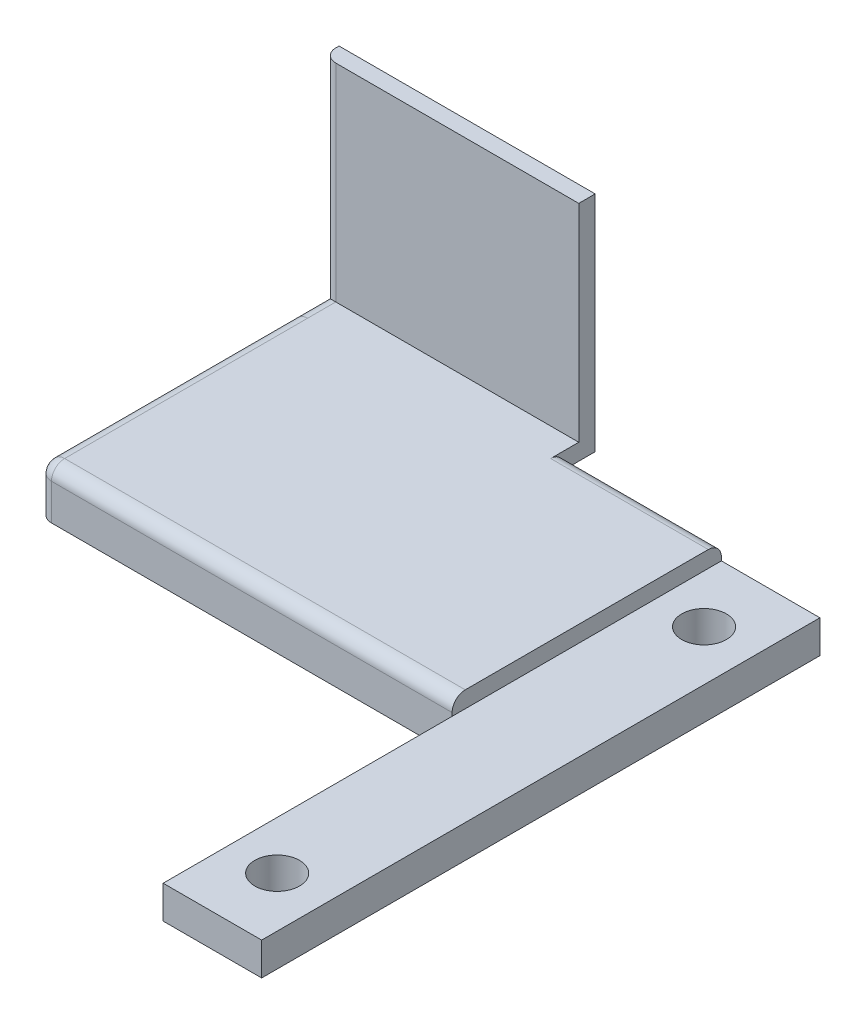
from build123d import *

# Parameters (mm, degrees)
SKETCH_1_W          = 40
SKETCH_1_H          = 85
EXTRUDE_1_DEPTH     = 5
SKETCH_2_W          = 25
SKETCH_2_H          = 85
EXTRUDE_2_DEPTH     = 2.5
EXTRUDE_START       = -7.5
SKETCH_5_W          = 38
SKETCH_5_H          = 85
EXTRUDE_3_DEPTH     = 7.5
SKETCH_3_R          = 3.4
CUT_EXTRUDE_1_DEPTH = 95.074438611
SKETCH_6_R          = 3.4
CUT_EXTRUDE_2_DEPTH = 95.074438611
FILLET_1_R          = 2
FILLET_2_R          = 2
SKETCH_7_W          = 63
SKETCH_7_H          = 17.986542749
CUT_EXTRUDE_3_DEPTH = 44
FILLET_3_R          = 2
EXTRUDE_4_DEPTH     = 39
FILLET_4_R          = 2


with BuildPart() as part:
    # 草图1 → 凸台-拉伸1 (new body)
    with BuildSketch(Plane(origin=(0, 0, 0), x_dir=(1, 0, 0), z_dir=(0, 1, 0))):
        with Locations((20, -42.5)):
            Rectangle(SKETCH_1_W, SKETCH_1_H)
    extrude(amount=EXTRUDE_1_DEPTH)

    # 草图2 → 凸台-拉伸2 (add)
    with BuildSketch(Plane(origin=(0, 5, 0), x_dir=(1, 0, 0), z_dir=(0, 1, 0))):
        with Locations((12.5, -42.5)):
            Rectangle(SKETCH_2_W, SKETCH_2_H)
    extrude(amount=EXTRUDE_2_DEPTH)

    # 草图5 → 凸台-拉伸3 (add)
    with BuildSketch(Plane.XZ.offset(EXTRUDE_START)):
        with Locations((-19, 42.5)):
            Rectangle(SKETCH_5_W, SKETCH_5_H)
    extrude(amount=EXTRUDE_3_DEPTH)

    # 草图3 → 切除-拉伸1 (cut, through all)
    with BuildSketch(Plane(origin=(0, 5, 0), x_dir=(1, 0, 0), z_dir=(0, 1, 0))):
        with Locations(Location((32.361090949, -75, 0), (0, 0, 270))):
            Circle(SKETCH_3_R)
    extrude(amount=-CUT_EXTRUDE_1_DEPTH, mode=Mode.SUBTRACT)

    # 草图6 → 切除-拉伸2 (cut, through all)
    with BuildSketch(Plane(origin=(0, 5, 0), x_dir=(1, 0, 0), z_dir=(0, 1, 0))):
        with Locations(Location((32.361090949, -10, 0), (0, 0, 270))):
            Circle(SKETCH_6_R)
    extrude(amount=-CUT_EXTRUDE_2_DEPTH, mode=Mode.SUBTRACT)

    # 圆角1
    fillet_1_edges = [part.edges().sort_by_distance(p)[0] for p in [
        (-6.5, 7.5, 85),
        (-38, 7.5, 42.5),
    ]]
    fillet(fillet_1_edges, radius=FILLET_1_R)

    # 圆角2
    # the kernel refuses this fillet: 2 mm, written as the material it takes off along each edge
    with BuildSketch(Plane(origin=(-36, 5.5, 83), x_dir=(0, 0, 1), z_dir=(-1, 0, 0))) as fillet_2_piece_1_section:
        Polygon((0, 0), (FILLET_2_R, 0), (FILLET_2_R, FILLET_2_R), (0, FILLET_2_R), align=None)
    fillet_2_piece_1 = extrude(amount=FILLET_2_R, mode=Mode.PRIVATE)
    fillet_2_piece_1 = fillet_2_piece_1 - Plane(origin=(-36, 5.5, 83), x_dir=(0, -0.7071067811865475, -0.7071067811865475), z_dir=(-1, 0, 0)) * Sphere(FILLET_2_R, mode=Mode.PRIVATE)
    add(fillet_2_piece_1, mode=Mode.SUBTRACT)
    with BuildSketch(Plane(origin=(-36, 7.5, 0), x_dir=(0, -1, 0), z_dir=(1, 0, 0))) as fillet_2_piece_2:
        with BuildLine():
            CenterArc((FILLET_2_R, -FILLET_2_R), FILLET_2_R, 90, 90)
            Line((0, -FILLET_2_R), (0, 0))
            Line((0, 0), (FILLET_2_R, 0))
        make_face()
    extrude(amount=66, mode=Mode.SUBTRACT)
    with BuildSketch(Plane(origin=(-38, 5.5, 85), x_dir=(0, 0, -1), z_dir=(0, -1, 0)), Plane(origin=(-38, 5.5, 0), x_dir=(1, 0, 0), z_dir=(0, -1, 0))) as fillet_2_piece_3:
        with BuildLine():
            CenterArc((FILLET_2_R, FILLET_2_R), FILLET_2_R, 180, 90)
            Line((0, FILLET_2_R), (0, 0))
            Line((0, 0), (FILLET_2_R, 0))
        make_face()
    extrude(amount=10.5, mode=Mode.SUBTRACT)
    with BuildSketch(Plane(origin=(-36, 5.5, 0), x_dir=(-1, 0, 0), z_dir=(0, -1, 0))) as fillet_2_piece_4:
        with BuildLine():
            CenterArc((2 - FILLET_2_R, -FILLET_2_R), FILLET_2_R, 0, 90)
            Line((2, -FILLET_2_R), (2, 0))
            Line((2, 0), (2 - FILLET_2_R, 0))
        make_face()
    revolve(axis=Axis((-36, 5.5, 0), (0, 0, -1)), revolution_arc=90, mode=Mode.SUBTRACT)

    # 草图7 → 切除-拉伸3 (cut)
    with BuildSketch(Plane.XY.offset(85)):
        with Locations((-6.5, 8.993271375)):
            Rectangle(SKETCH_7_W, SKETCH_7_H)
    extrude(amount=-CUT_EXTRUDE_3_DEPTH, mode=Mode.SUBTRACT)

    # 圆角3
    fillet_3_edges = [part.edges().sort_by_distance(p)[0] for p in [
        (-37.414213562, 6.914213562, 41),
        (-5.5, 7.5, 41),
        (-38, 2.75, 41),
    ]]
    fillet(fillet_3_edges, radius=FILLET_3_R)

    # 草图8 → 凸台-拉伸4 (add)
    with BuildSketch(Plane.ZY.offset(38)):
        Polygon((-1.392069631, 5), (2, 5), (2, 5.5), (2, 7.5), (-2.284139263, 7.5), (-2.284139263, 39), (-4.784139263, 39), (-4.784139263, 7.572997811), (-4.784139263, 5), align=None)
    extrude(amount=-EXTRUDE_4_DEPTH)

    # 圆角4
    fillet_4_edges = [part.edges().sort_by_distance(p)[0] for p in [
        (-38, 23.25, -2.284139263),
        (-38, 7.5, -0.142069631),
    ]]
    fillet(fillet_4_edges, radius=FILLET_4_R)


solid = part.part
